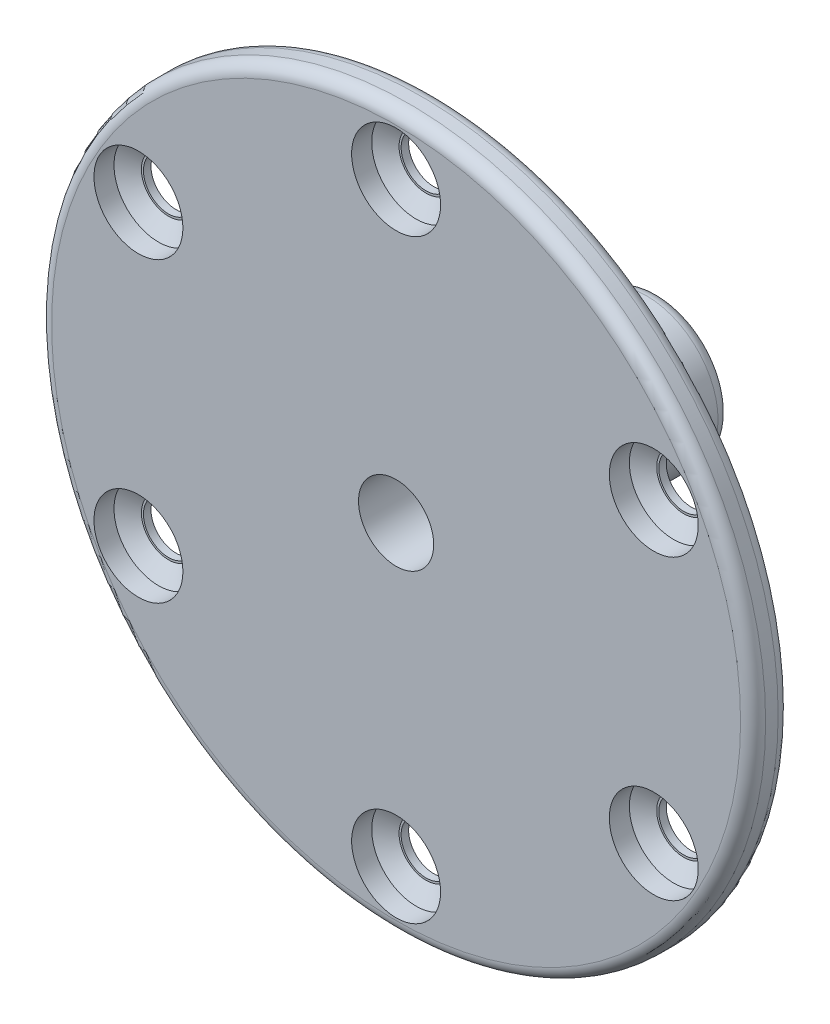
from build123d import *
from OCP.BRepFilletAPI import BRepFilletAPI_MakeChamfer

# Parameters (mm, degrees)
SKETCH1_R                      = 28.5
SKETCH1_R_2                    = 5.7
SKETCH1_R_3                    = 2
SKETCH1_R_4                    = 3
BOSS_EXTRUDE1_DEPTH            = 3
SKETCH2_R                      = 3.55
CUT_EXTRUDE1_DEPTH             = 2.4
BOSS_EXTRUDE2_START            = -12
SKETCH1_4_R                    = 5.7
SKETCH1_4_R_2                  = 3
BOSS_EXTRUDE2_DEPTH            = 12
BOSS_EXTRUDE3_START            = 6
SKETCH4_R                      = 5.7
SKETCH4_R_2                    = 2
BOSS_EXTRUDE3_DEPTH            = 6
CUT_EXTRUDE2_REACH             = 46.142
SKETCH3_R                      = 1.5
CUT_EXTRUDE2_DIRECTION_2_REACH = 46.142
FILLET1_R                      = 1
CHAMFER1_SIZE                  = 1.4
CHAMFER2_SIZE                  = 0.8
CHAMFER2_SIZE2                 = 1.385640646


with BuildPart() as part:
    # Sketch1 → Boss-Extrude1 (new body)
    # profile 1 of 2: a face of its own
    with BuildSketch(Plane(origin=(0, 0, 0), x_dir=(0, 1, 0), z_dir=(0, 0, 1))):
        with Locations(Location((0, 0, 0), (0, 0, 270))):
            Circle(SKETCH1_R)
        Circle(SKETCH1_R_2, mode=Mode.SUBTRACT)
        with Locations(Location((-23.75, 0, 0), (0, 0, 270))):
            Circle(SKETCH1_R_3, mode=Mode.SUBTRACT)
        with Locations(Location((-11.875, 20.56810334, 0), (0, 0, 270))):
            Circle(SKETCH1_R_3, mode=Mode.SUBTRACT)
        with Locations(Location((11.875, 20.56810334, 0), (0, 0, 270))):
            Circle(SKETCH1_R_3, mode=Mode.SUBTRACT)
        with Locations(Location((23.75, 0, 0), (0, 0, 270))):
            Circle(SKETCH1_R_3, mode=Mode.SUBTRACT)
        with Locations(Location((11.875, -20.56810334, 0), (0, 0, 270))):
            Circle(SKETCH1_R_3, mode=Mode.SUBTRACT)
        with Locations(Location((-11.875, -20.56810334, 0), (0, 0, 270))):
            Circle(SKETCH1_R_3, mode=Mode.SUBTRACT)
    # profile 2 of 2: a face of its own
    with BuildSketch(Plane(origin=(0, 0, 0), x_dir=(0, 1, 0), z_dir=(0, 0, 1))):
        Circle(SKETCH1_R_2)
        with Locations(Location((0, 0, 0), (0, 0, 270))):
            Circle(SKETCH1_R_4, mode=Mode.SUBTRACT)
    extrude(amount=BOSS_EXTRUDE1_DEPTH)

    # Sketch2 → Cut-Extrude1 (cut)
    with BuildSketch(Plane.XY.offset(3)):
        with Locations((-20.56810334, -11.875)):
            Circle(SKETCH2_R)
        with Locations((-20.56810334, 11.875)):
            Circle(SKETCH2_R)
        with Locations((0, 23.75)):
            Circle(SKETCH2_R)
        with Locations((20.56810334, 11.875)):
            Circle(SKETCH2_R)
        with Locations((20.56810334, -11.875)):
            Circle(SKETCH2_R)
        with Locations((0, -23.75)):
            Circle(SKETCH2_R)
    extrude(amount=-CUT_EXTRUDE1_DEPTH, mode=Mode.SUBTRACT)

    # Sketch1<4> → Boss-Extrude2 (add)
    with BuildSketch(Plane(origin=(0, 0, 0), x_dir=(0, 1, 0), z_dir=(0, 0, 1)).offset(BOSS_EXTRUDE2_START)):
        with Locations(Location((0, 0, 0), (0, 0, 270))):
            Circle(SKETCH1_4_R)
        with Locations(Location((0, 0, 0), (0, 0, 270))):
            Circle(SKETCH1_4_R_2, mode=Mode.SUBTRACT)
    extrude(amount=BOSS_EXTRUDE2_DEPTH)

    # Sketch4 → Boss-Extrude3 (add)
    with BuildSketch(Plane(origin=(0, 0, -12), x_dir=(1, 0, 0), z_dir=(0, 0, -1)).offset(BOSS_EXTRUDE3_START)):
        Circle(SKETCH4_R)
        with Locations(Location((0, 0, 0), (0, 0, 180))):
            Circle(SKETCH4_R_2, mode=Mode.SUBTRACT)
    extrude(amount=-BOSS_EXTRUDE3_DEPTH)

    # Sketch3 → Cut-Extrude2 (cut, up to next)
    with BuildSketch(Plane(origin=(0, 0, 0), x_dir=(-1, 0, 0), z_dir=(0, 1, 0)), mode=Mode.PRIVATE) as cut_extrude2_sk1:
        with Locations(Location((0, -4, 0), (0, 0, 90))):
            Circle(SKETCH3_R)
    cut_extrude2_tool1 = extrude(cut_extrude2_sk1.sketch, amount=-CUT_EXTRUDE2_REACH, mode=Mode.PRIVATE) & part.part
    add(cut_extrude2_tool1.solids().sort_by_distance((0, 0, -4))[0], mode=Mode.SUBTRACT)

    # Sketch3 → Cut-Extrude2 direction 2 (cut, up to next)
    with BuildSketch(Plane(origin=(0, 0, 0), x_dir=(-1, 0, 0), z_dir=(0, 1, 0)), mode=Mode.PRIVATE) as cut_extrude2_direction_2_sk1:
        with Locations(Location((0, -4, 0), (0, 0, 90))):
            Circle(SKETCH3_R)
    cut_extrude2_direction_2_tool1 = extrude(cut_extrude2_direction_2_sk1.sketch, amount=CUT_EXTRUDE2_DIRECTION_2_REACH, mode=Mode.PRIVATE) & part.part
    add(cut_extrude2_direction_2_tool1.solids().sort_by_distance((0, 0, -4))[0], mode=Mode.SUBTRACT)

    # Fillet1
    fillet1_edges = [part.edges().sort_by_distance(p)[0] for p in [
        (-28.5, 0, 0),
        (-28.5, 0, 3),
        (-5.7, 0, 0),
        (-5.7, 0, -18),
    ]]
    fillet(fillet1_edges, radius=FILLET1_R)

    # Chamfer1
    # the kernel refuses this chamfer: 1.4 mm, written as the material it takes off along each edge
    with BuildSketch(Plane(origin=(0, 0, -12), x_dir=(-1, 0, 0), z_dir=(0, -1, 0))) as chamfer1_piece_1_section:
        Polygon((2 + CHAMFER1_SIZE, 0), (2, CHAMFER1_SIZE), (2, 0), align=None)
    chamfer1_piece_1 = revolve(axis=Axis((0, 0, -12), (0, 0, -1)), mode=Mode.PRIVATE)
    chamfer1_piece_1 = chamfer1_piece_1 & Plane(origin=(0, 0, -12.902493822), x_dir=(1, 0, 0), z_dir=(0, 0, -1)) * Cylinder(3, 14, mode=Mode.PRIVATE)
    add(chamfer1_piece_1, mode=Mode.SUBTRACT)

    # Chamfer2: one chamfer whose edges measure the first distance from different faces: ONE call of the kernel's chamfer builder (chamfer() names one face for all edges)
    chamfer2_edges_1 = [part.edges().sort_by_distance(p)[0] for p in [
        (-3.55, -23.75, 0.6),
    ]]
    chamfer2_side_1 = [part.faces().sort_by_distance(p)[0] for p in [
        (-3.55, -23.75, 1.8),
    ]]
    chamfer2_edges_2 = [part.edges().sort_by_distance(p)[0] for p in [
        (17.01810334, -11.875, 0.6),
    ]]
    chamfer2_side_2 = [part.faces().sort_by_distance(p)[0] for p in [
        (17.01810334, -11.875, 1.8),
    ]]
    chamfer2_edges_3 = [part.edges().sort_by_distance(p)[0] for p in [
        (17.01810334, 11.875, 0.6),
    ]]
    chamfer2_side_3 = [part.faces().sort_by_distance(p)[0] for p in [
        (17.01810334, 11.875, 1.8),
    ]]
    chamfer2_edges_4 = [part.edges().sort_by_distance(p)[0] for p in [
        (-3.55, 23.75, 0.6),
    ]]
    chamfer2_side_4 = [part.faces().sort_by_distance(p)[0] for p in [
        (-3.55, 23.75, 1.8),
    ]]
    chamfer2_edges_5 = [part.edges().sort_by_distance(p)[0] for p in [
        (-24.11810334, 11.875, 0.6),
    ]]
    chamfer2_side_5 = [part.faces().sort_by_distance(p)[0] for p in [
        (-24.11810334, 11.875, 1.8),
    ]]
    chamfer2_edges_6 = [part.edges().sort_by_distance(p)[0] for p in [
        (-24.11810334, -11.875, 0.6),
    ]]
    chamfer2_side_6 = [part.faces().sort_by_distance(p)[0] for p in [
        (-24.11810334, -11.875, 1.8),
    ]]
    chamfer2 = BRepFilletAPI_MakeChamfer(part.part.solid().wrapped)
    for e in chamfer2_edges_1:
        chamfer2.Add(CHAMFER2_SIZE, CHAMFER2_SIZE2, e.wrapped, chamfer2_side_1[0].wrapped)  # the first distance lies on this face
    for e in chamfer2_edges_2:
        chamfer2.Add(CHAMFER2_SIZE, CHAMFER2_SIZE2, e.wrapped, chamfer2_side_2[0].wrapped)  # the first distance lies on this face
    for e in chamfer2_edges_3:
        chamfer2.Add(CHAMFER2_SIZE, CHAMFER2_SIZE2, e.wrapped, chamfer2_side_3[0].wrapped)  # the first distance lies on this face
    for e in chamfer2_edges_4:
        chamfer2.Add(CHAMFER2_SIZE, CHAMFER2_SIZE2, e.wrapped, chamfer2_side_4[0].wrapped)  # the first distance lies on this face
    for e in chamfer2_edges_5:
        chamfer2.Add(CHAMFER2_SIZE, CHAMFER2_SIZE2, e.wrapped, chamfer2_side_5[0].wrapped)  # the first distance lies on this face
    for e in chamfer2_edges_6:
        chamfer2.Add(CHAMFER2_SIZE, CHAMFER2_SIZE2, e.wrapped, chamfer2_side_6[0].wrapped)  # the first distance lies on this face
    add(Compound.cast(chamfer2.Shape()), mode=Mode.REPLACE)


solid = part.part
